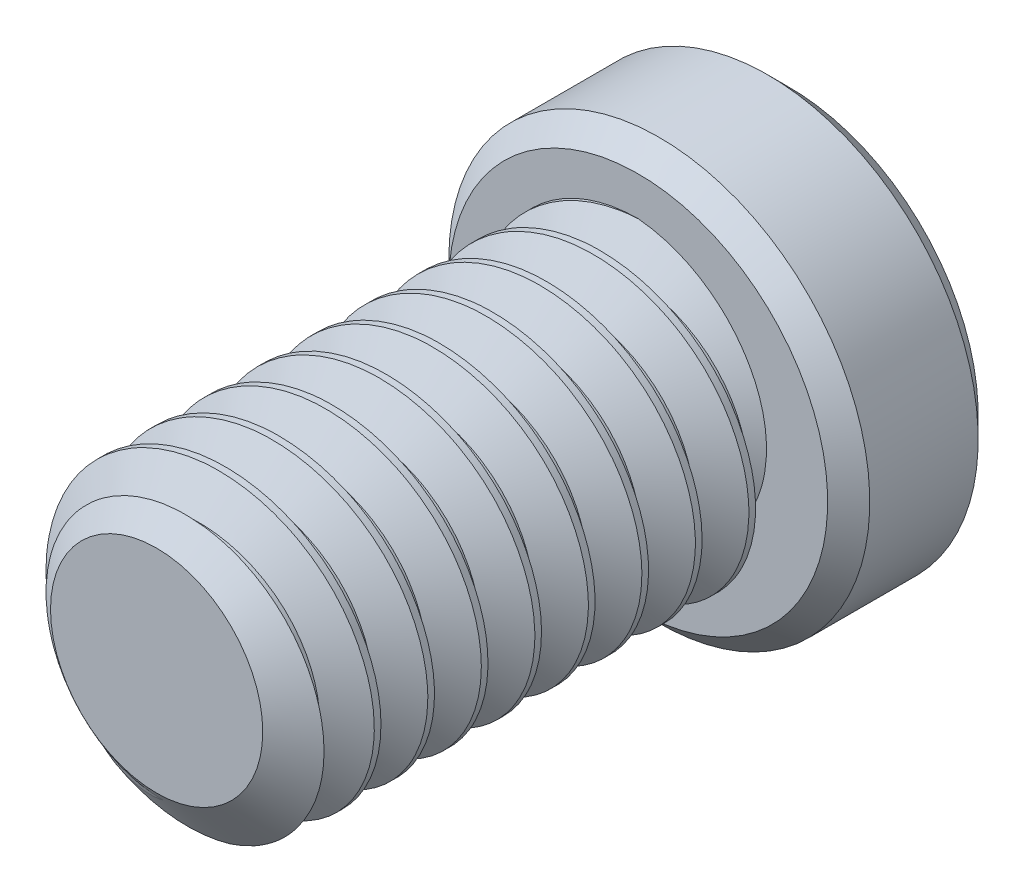
from build123d import *

# Parameters (mm, degrees)
SKETCH1_R          = 3.96875
EXTRUDE1_DEPTH     = 12.7
CUT_SWEEP1_PITCH   = 1.411111111
SKETCH6_R          = 5.5499
EXTRUDE2_DEPTH     = 3.96875
CUT_EXTRUDE1_DEPTH = 2.9765625
CHAMFER1_SIZE      = 0.55499


with BuildPart() as part:
    # Sketch1 → Extrude1 (new body)
    with BuildSketch(Plane.XY):
        Circle(SKETCH1_R)
    extrude(amount=-EXTRUDE1_DEPTH)

    # Cut-Sweep1: the profile of Sketch3 profile screwed along a right-hand helix of 10 turns, 6 arcs to a turn; built about Z, then put on its axis
    cut_sweep1_z = Axis((0, 0, 0), (0, 0, 1))
    cut_sweep1_corners = [(3.96905, 0, -1.234895427), (3.052206448, 0, -0.705555556), (3.052206448, 0, -0.529166667), (3.96905, 0, 0.000173205)]
    with BuildLine(mode=Mode.PRIVATE) as cut_sweep1_profile:
        Line(cut_sweep1_corners[0], cut_sweep1_corners[1])
        Line(cut_sweep1_corners[1], cut_sweep1_corners[2])
        Line(cut_sweep1_corners[2], cut_sweep1_corners[3])
        Line(cut_sweep1_corners[3], cut_sweep1_corners[0])
    cut_sweep1_cap = Face(cut_sweep1_profile.wire())
    cut_sweep1_turn_angles = [0, 30, 60, 90, 120, 150, 180, 210, 240, 270, 300, 330, 360]
    cut_sweep1_turn_weights = [1, 0.8660254037844387, 1, 0.8660254037844387, 1, 0.8660254037844387, 1, 0.8660254037844387, 1, 0.8660254037844387, 1, 0.8660254037844387, 1]
    cut_sweep1_turn_rails = [Edge.make_bspline([Vector(p[0], p[1], 0).rotate(cut_sweep1_z, cut_sweep1_turn_angles[k]) / cut_sweep1_turn_weights[k] + Vector(0, 0, p[2] + CUT_SWEEP1_PITCH * cut_sweep1_turn_angles[k] / 360) for k in range(13)], [0, 0, 0, 1, 1, 2, 2, 3, 3, 4, 4, 5, 5, 6, 6, 6], 2, cut_sweep1_turn_weights) for p in cut_sweep1_corners]
    cut_sweep1_turn_sides = [Face.make_surface_from_curves(cut_sweep1_turn_rails[p[0]], cut_sweep1_turn_rails[p[1]]) for p in [(0, 1), (1, 2), (2, 3), (3, 0)]]
    cut_sweep1 = Plane(origin=(0, 0, 0), x_dir=(0, 1, 0), z_dir=(0, 0, -1)) * Solid(Shell([*[p.moved(Location((0, 0, CUT_SWEEP1_PITCH * i))) for i in range(10) for p in cut_sweep1_turn_sides], cut_sweep1_cap, cut_sweep1_cap.rotate(cut_sweep1_z, 3600).moved(Location((0, 0, CUT_SWEEP1_PITCH * 3600 / 360)))]))
    add(cut_sweep1, mode=Mode.SUBTRACT)

    # Sketch4 → Cut-Revolve1 (revolve, cut)
    with BuildSketch(Plane(origin=(0, 0, 0), x_dir=(0, 0, -1), z_dir=(1, 0, 0)), mode=Mode.PRIVATE) as cut_revolve1_sk:
        Polygon((0.819623419, 3.96875), (0, 2.798206448), (0, 3.96875), align=None)
    revolve(cut_revolve1_sk.sketch.rotate(Axis((0, 0, 0), (0, 0, -1)), 224.846133378), axis=Axis((0, 0, 0), (0, 0, -1)), mode=Mode.SUBTRACT)

    # Sketch6 → Extrude2 (add)
    with BuildSketch(Plane(origin=(0, 0, -12.7), x_dir=(-1, 0, 0), z_dir=(0, 0, -1))):
        Circle(SKETCH6_R)
    extrude(amount=EXTRUDE2_DEPTH)

    # Sketch7 → Cut-Extrude1 (cut)
    with BuildSketch(Plane(origin=(0, 0, -16.66875), x_dir=(-1, 0, 0), z_dir=(0, 0, -1))):
        Polygon((0, 2.291358881), (-1.984375, 1.14567944), (-1.984375, -1.14567944), (0, -2.291358881), (1.984375, -1.14567944), (1.984375, 1.14567944), align=None)
    extrude(amount=-CUT_EXTRUDE1_DEPTH, mode=Mode.SUBTRACT)

    # Cut-Extrude2 cone 1 section (through the dimple's axis) → Cut-Extrude2 (revolve, cut)
    with BuildSketch(Plane(origin=(0, 0, -16.66875), x_dir=(0, 1, 0), z_dir=(1, 0, 0))):
        Polygon((0, 0), (2.291358881, 0), (0, 2.291358881), align=None)
    revolve(axis=Axis((0, 0, -16.66875), (0, 0, 1)), mode=Mode.SUBTRACT)

    # Chamfer1
    chamfer1_edges = [part.edges().sort_by_distance(p)[0] for p in [
        (5.5499, 0, -12.7),
        (5.5499, 0, -16.66875),
    ]]
    chamfer(chamfer1_edges, length=CHAMFER1_SIZE)


solid = part.part
